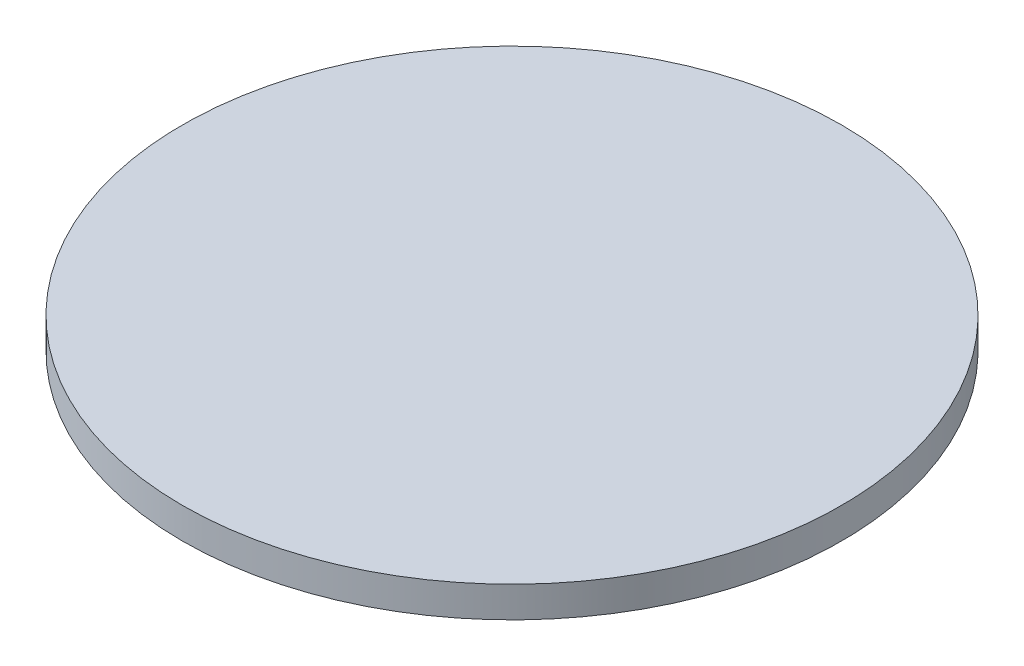
from build123d import *

# Parameters (mm, degrees)
SKETCH1_R           = 32
BOSS_EXTRUDE1_DEPTH = 3


with BuildPart() as part:
    # Sketch1 → Boss-Extrude1 (new body)
    with BuildSketch(Plane(origin=(0, 0, 0), x_dir=(1, 0, 0), z_dir=(0, 1, 0))):
        Circle(SKETCH1_R)
    extrude(amount=BOSS_EXTRUDE1_DEPTH)


solid = part.part
